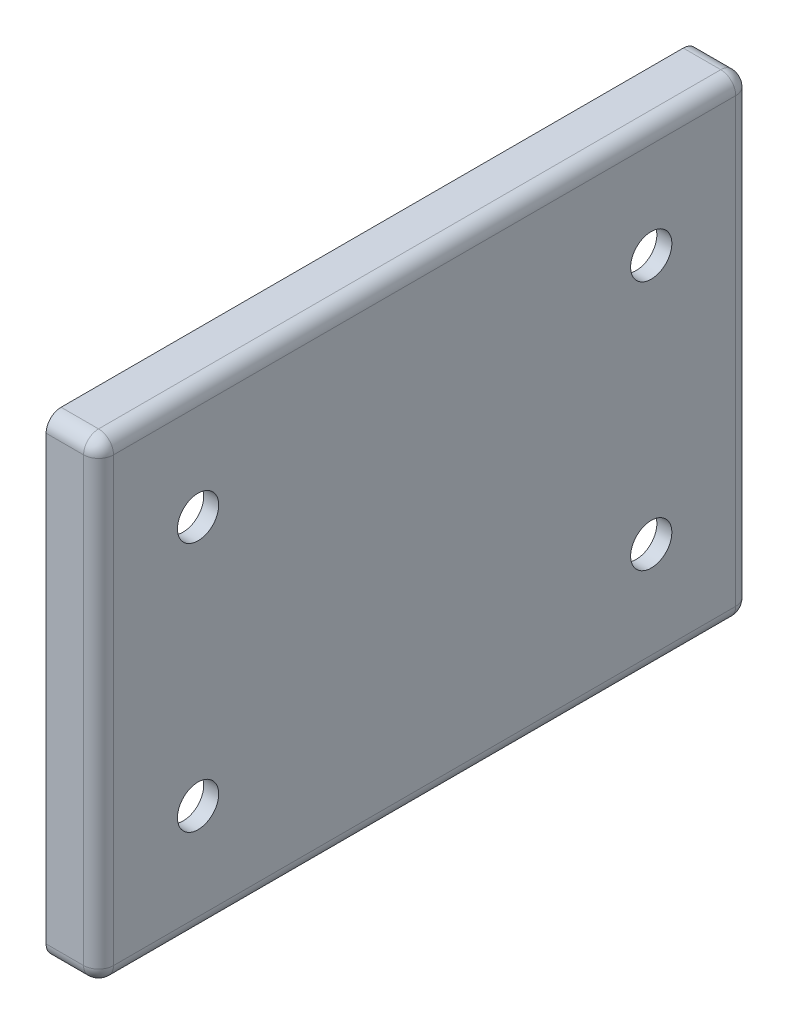
from build123d import *

# Parameters (mm, degrees)
SKETCH_1_W          = 87
SKETCH_1_H          = 63
SKETCH_1_W_2        = 83
SKETCH_1_H_2        = 59
EXTRUDE_1_DEPTH     = 5
SKETCH_2_W          = 87
SKETCH_2_H          = 63
EXTRUDE_2_DEPTH     = 2
SKETCH_3_W          = 2.764626384
SKETCH_3_H          = 4.6515936
CUT_EXTRUDE_1_DEPTH = 2
FILLET_1_R          = 2
SKETCH_4_W          = 27.388964673
SKETCH_4_H          = 3.905856672
SKETCH_4_W_2        = 13.70635998
SKETCH_4_H_2        = 4.505719406
SKETCH_4_W_3        = 11.157018238
SKETCH_4_H_3        = 2.851387493
SKETCH_4_W_4        = 3.109085913
SKETCH_4_H_4        = 44.489819457
EXTRUDE_3_DEPTH     = 3.3
SKETCH_5_R          = 2.75
CUT_EXTRUDE_2_DEPTH = 10


with BuildPart() as part:
    # 草图1 → 凸台-拉伸1 (new body)
    with BuildSketch(Plane(origin=(0, 0, 0), x_dir=(0, 0, -1), z_dir=(1, 0, 0))):
        with Locations((3.90387463, 17.013155975)):
            Rectangle(SKETCH_1_W, SKETCH_1_H)
        with Locations((3.90387463, 17.013155975)):
            Rectangle(SKETCH_1_W_2, SKETCH_1_H_2, mode=Mode.SUBTRACT)
    extrude(amount=EXTRUDE_1_DEPTH)

    # 草图2 → 凸台-拉伸2 (add)
    with BuildSketch(Plane(origin=(5, 0, 0), x_dir=(0, 0, -1), z_dir=(1, 0, 0))):
        with Locations((3.90387463, 17.013155975)):
            Rectangle(SKETCH_2_W, SKETCH_2_H)
    extrude(amount=EXTRUDE_2_DEPTH)

    # 草图3 → 切除-拉伸1 (cut)
    with BuildSketch(Plane(origin=(0, 0, -47.40387463), x_dir=(-1, 0, 0), z_dir=(0, 0, -1))):
        with Locations((-3.662779601, -6.806448474)):
            Rectangle(SKETCH_3_W, SKETCH_3_H)
    extrude(amount=-CUT_EXTRUDE_1_DEPTH, mode=Mode.SUBTRACT)

    # 圆角1
    # the kernel refuses this fillet: 2 mm, written as the material it takes off along each edge
    with BuildSketch(Plane(origin=(5, 46.513155975, -45.40387463), x_dir=(1, 0, 0), z_dir=(0, 1, 0))) as fillet_1_piece_1_section:
        Polygon((0, 0), (FILLET_1_R, 0), (FILLET_1_R, FILLET_1_R), (0, FILLET_1_R), align=None)
    fillet_1_piece_1 = extrude(amount=FILLET_1_R, mode=Mode.PRIVATE)
    fillet_1_piece_1 = fillet_1_piece_1 - Plane(origin=(5, 46.513155975, -45.40387463), x_dir=(-0.7071067811865475, 0, 0.7071067811865475), z_dir=(0, 1, 0)) * Sphere(FILLET_1_R, mode=Mode.PRIVATE)
    add(fillet_1_piece_1, mode=Mode.SUBTRACT)
    with BuildSketch(Plane(origin=(5, -12.486844025, -45.40387463), x_dir=(0, 0, -1), z_dir=(1, 0, 0))) as fillet_1_piece_2_section:
        Polygon((0, 0), (FILLET_1_R, 0), (FILLET_1_R, -FILLET_1_R), (0, -FILLET_1_R), align=None)
    fillet_1_piece_2 = extrude(amount=FILLET_1_R, mode=Mode.PRIVATE)
    fillet_1_piece_2 = fillet_1_piece_2 - Plane(origin=(5, -12.486844025, -45.40387463), x_dir=(0, 0.7071067811865474, 0.7071067811865476), z_dir=(1, 0, 0)) * Sphere(FILLET_1_R, mode=Mode.PRIVATE)
    add(fillet_1_piece_2, mode=Mode.SUBTRACT)
    with BuildSketch(Plane(origin=(5, -12.486844025, 37.59612537), x_dir=(1, 0, 0), z_dir=(0, 0, 1))) as fillet_1_piece_3_section:
        Polygon((0, 0), (FILLET_1_R, 0), (FILLET_1_R, -FILLET_1_R), (0, -FILLET_1_R), align=None)
    fillet_1_piece_3 = extrude(amount=FILLET_1_R, mode=Mode.PRIVATE)
    fillet_1_piece_3 = fillet_1_piece_3 - Plane(origin=(5, -12.486844025, 37.59612537), x_dir=(-0.7071067811865475, 0.7071067811865475, 0), z_dir=(0, 0, 1)) * Sphere(FILLET_1_R, mode=Mode.PRIVATE)
    add(fillet_1_piece_3, mode=Mode.SUBTRACT)
    with BuildSketch(Plane(origin=(5, 46.513155975, 37.59612537), x_dir=(0, 0, 1), z_dir=(0, 1, 0))) as fillet_1_piece_4_section:
        Polygon((0, 0), (FILLET_1_R, 0), (FILLET_1_R, FILLET_1_R), (0, FILLET_1_R), align=None)
    fillet_1_piece_4 = extrude(amount=FILLET_1_R, mode=Mode.PRIVATE)
    fillet_1_piece_4 = fillet_1_piece_4 - Plane(origin=(5, 46.513155975, 37.59612537), x_dir=(-0.7071067811865475, 0, -0.7071067811865475), z_dir=(0, 1, 0)) * Sphere(FILLET_1_R, mode=Mode.PRIVATE)
    add(fillet_1_piece_4, mode=Mode.SUBTRACT)
    with BuildSketch(Plane(origin=(5, 48.513155975, -47.40387463), x_dir=(0, 0, 1), z_dir=(-1, 0, 0)), Plane(origin=(5, -14.486844025, -47.40387463), x_dir=(0, 1, 0), z_dir=(-1, 0, 0)), Plane(origin=(-5, -14.486844025, 39.59612537), x_dir=(0, 1, 0), z_dir=(1, 0, 0)), Plane(origin=(-5, 48.513155975, 39.59612537), x_dir=(0, 0, -1), z_dir=(1, 0, 0))) as fillet_1_piece_5:
        with BuildLine():
            CenterArc((FILLET_1_R, -FILLET_1_R), FILLET_1_R, 90, 90)
            Line((0, -FILLET_1_R), (0, 0))
            Line((0, 0), (FILLET_1_R, 0))
        make_face()
    extrude(amount=10, mode=Mode.SUBTRACT)
    with BuildSketch(Plane(origin=(7, 48.513155975, 37.59612537), x_dir=(-1, 0, 0), z_dir=(0, 0, -1))) as fillet_1_piece_6:
        with BuildLine():
            CenterArc((FILLET_1_R, -FILLET_1_R), FILLET_1_R, 90, 90)
            Line((0, -FILLET_1_R), (0, 0))
            Line((0, 0), (FILLET_1_R, 0))
        make_face()
    extrude(amount=83, mode=Mode.SUBTRACT)
    with BuildSketch(Plane(origin=(7, 46.513155975, -47.40387463), x_dir=(0, 0, 1), z_dir=(0, -1, 0))) as fillet_1_piece_7:
        with BuildLine():
            CenterArc((FILLET_1_R, FILLET_1_R), FILLET_1_R, 180, 90)
            Line((0, FILLET_1_R), (0, 0))
            Line((0, 0), (FILLET_1_R, 0))
        make_face()
    extrude(amount=59, mode=Mode.SUBTRACT)
    with BuildSketch(Plane(origin=(7, -14.486844025, -45.40387463), x_dir=(0, 1, 0), z_dir=(0, 0, 1))) as fillet_1_piece_8:
        with BuildLine():
            CenterArc((FILLET_1_R, FILLET_1_R), FILLET_1_R, 180, 90)
            Line((0, FILLET_1_R), (0, 0))
            Line((0, 0), (FILLET_1_R, 0))
        make_face()
    extrude(amount=83, mode=Mode.SUBTRACT)
    with BuildSketch(Plane(origin=(7, -12.486844025, 39.59612537), x_dir=(-1, 0, 0), z_dir=(0, 1, 0))) as fillet_1_piece_9:
        with BuildLine():
            CenterArc((FILLET_1_R, -FILLET_1_R), FILLET_1_R, 90, 90)
            Line((0, -FILLET_1_R), (0, 0))
            Line((0, 0), (FILLET_1_R, 0))
        make_face()
    extrude(amount=59, mode=Mode.SUBTRACT)

    # 草图4 → 凸台-拉伸3 (add)
    with BuildSketch(Plane.ZY.offset(-5)):
        with Locations((13.694482337, -10.533915689)):
            Rectangle(SKETCH_4_W, SKETCH_4_H)
        with Locations((-38.55069464, 44.260296272)):
            Rectangle(SKETCH_4_W_2, SKETCH_4_H_2)
        with Locations((32.017616251, 45.087462229)):
            Rectangle(SKETCH_4_W_3, SKETCH_4_H_3)
        with Locations((36.041582414, 16.563258925)):
            Rectangle(SKETCH_4_W_4, SKETCH_4_H_4)
    extrude(amount=EXTRUDE_3_DEPTH)

    # 草图5 → 切除-拉伸2 (cut)
    with BuildSketch(Plane.ZY.offset(-5)):
        with Locations((-34.13110136, 33.698944985)):
            Circle(SKETCH_5_R)
        with Locations((26.3233521, 33.698944985)):
            Circle(SKETCH_5_R)
        with Locations((-34.13110136, 0.327366965)):
            Circle(SKETCH_5_R)
        with Locations((26.3233521, 0.327366965)):
            Circle(SKETCH_5_R)
    extrude(amount=-CUT_EXTRUDE_2_DEPTH, mode=Mode.SUBTRACT)


solid = part.part
